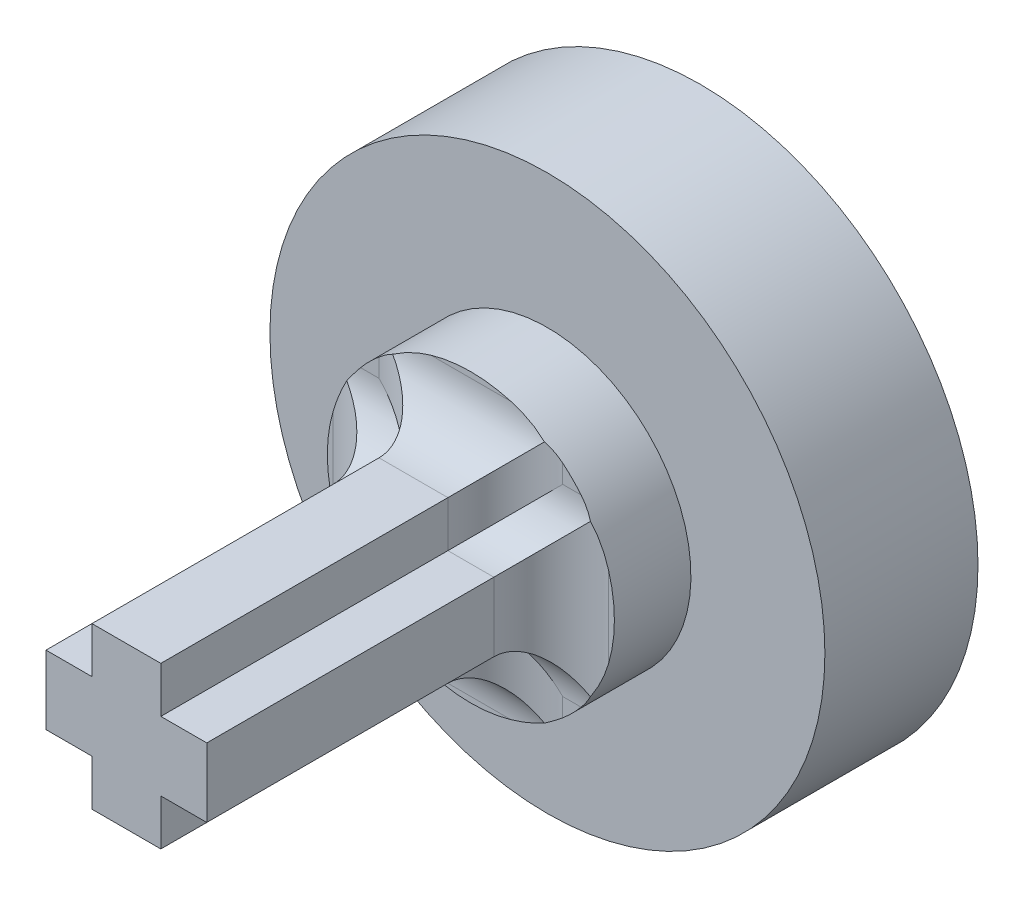
from build123d import *

# Parameters (mm, degrees)
SKETCH_1_W          = 1.8
SKETCH_1_H          = 4.2
SKETCH_1_W_2        = 4.2
SKETCH_1_H_2        = 1.8
EXTRUDE_1_DEPTH     = 9
SKETCH_3_R          = 3.75
EXTRUDE_5_DEPTH     = 2
FILLET_2_R          = 1.5
SKETCH_8_R          = 7.25
EXTRUDE_6_DEPTH     = 4
CUT_EXTRUDE_1_DEPTH = 5


with BuildPart() as part:
    # 草图1 → 凸台-拉伸1 (new body)
    with BuildSketch(Plane.XY):
        Rectangle(SKETCH_1_W, SKETCH_1_H)
        Rectangle(SKETCH_1_W_2, SKETCH_1_H_2)
    extrude(amount=EXTRUDE_1_DEPTH)

    # 草图3 → 凸台-拉伸5 (add)
    with BuildSketch(Plane(origin=(0, 0, 0), x_dir=(-1, 0, 0), z_dir=(0, 0, -1))):
        Circle(SKETCH_3_R)
    extrude(amount=EXTRUDE_5_DEPTH)

    # 圆角2
    # the kernel refuses this fillet: 1.5 mm, written as the material it adds along each edge
    with BuildSketch(Plane(origin=(-2.85, -0.9, 0), x_dir=(0, -1, 0), z_dir=(1, 0, 0))) as fillet_2_piece_1_section:
        with BuildLine():
            CenterArc((FILLET_2_R, -FILLET_2_R), FILLET_2_R, 90, 90)
            Line((0, -FILLET_2_R), (0, 0))
            Line((0, 0), (FILLET_2_R, 0))
        make_face()
    fillet_2_piece_1 = extrude(amount=4.95, mode=Mode.PRIVATE)
    fillet_2_piece_1 = split(fillet_2_piece_1, bisect_by=Plane(origin=(-2.1, -1.239592671, 0.339592671), z_dir=(1, 0, 0)), keep=Keep.TOP, mode=Mode.PRIVATE)
    add(fillet_2_piece_1)
    with BuildSketch(Plane(origin=(2.1, 0.9, 0), x_dir=(0, 1, 0), z_dir=(-1, 0, 0))) as fillet_2_piece_2_section:
        with BuildLine():
            CenterArc((FILLET_2_R, -FILLET_2_R), FILLET_2_R, 90, 90)
            Line((0, -FILLET_2_R), (0, 0))
            Line((0, 0), (FILLET_2_R, 0))
        make_face()
    fillet_2_piece_2 = extrude(amount=4.95, mode=Mode.PRIVATE)
    fillet_2_piece_2 = split(fillet_2_piece_2, bisect_by=Plane(origin=(-2.1, 1.239592671, 0.339592671), z_dir=(1, 0, 0)), keep=Keep.TOP, mode=Mode.PRIVATE)
    add(fillet_2_piece_2)
    with BuildSketch(Plane(origin=(-0.9, -2.1, 0), x_dir=(0, -1, 0), z_dir=(1, 0, 0)), Plane(origin=(0.9, 2.1, 0), x_dir=(0, 1, 0), z_dir=(-1, 0, 0)), Plane(origin=(-2.1, 0.9, 0), x_dir=(-1, 0, 0), z_dir=(0, -1, 0)), Plane(origin=(2.1, -0.9, 0), x_dir=(1, 0, 0), z_dir=(0, 1, 0))) as fillet_2_piece_3:
        with BuildLine():
            CenterArc((FILLET_2_R, -FILLET_2_R), FILLET_2_R, 90, 90)
            Line((0, -FILLET_2_R), (0, 0))
            Line((0, 0), (FILLET_2_R, 0))
        make_face()
    extrude(amount=1.8)
    with BuildSketch(Plane(origin=(0.9, -2.1, 0), x_dir=(1, 0, 0), z_dir=(0, 1, 0))) as fillet_2_piece_4_section:
        with BuildLine():
            CenterArc((FILLET_2_R, -FILLET_2_R), FILLET_2_R, 90, 90)
            Line((0, -FILLET_2_R), (0, 0))
            Line((0, 0), (FILLET_2_R, 0))
        make_face()
    fillet_2_piece_4 = extrude(amount=4.95, mode=Mode.PRIVATE)
    fillet_2_piece_4 = split(fillet_2_piece_4, bisect_by=Plane(origin=(1.239592671, 2.1, 0.339592671), z_dir=(0, -1, 0)), keep=Keep.TOP, mode=Mode.PRIVATE)
    add(fillet_2_piece_4)
    with BuildSketch(Plane(origin=(0.9, -2.85, 0), x_dir=(1, 0, 0), z_dir=(0, 1, 0))) as fillet_2_piece_5_section:
        with BuildLine():
            CenterArc((FILLET_2_R, -FILLET_2_R), FILLET_2_R, 90, 90)
            Line((0, -FILLET_2_R), (0, 0))
            Line((0, 0), (FILLET_2_R, 0))
        make_face()
    fillet_2_piece_5 = extrude(amount=4.95, mode=Mode.PRIVATE)
    fillet_2_piece_5 = split(fillet_2_piece_5, bisect_by=Plane(origin=(1.239592671, -2.1, 0.339592671), z_dir=(0, 1, 0)), keep=Keep.TOP, mode=Mode.PRIVATE)
    add(fillet_2_piece_5)
    with BuildSketch(Plane(origin=(-0.9, 2.85, 0), x_dir=(-1, 0, 0), z_dir=(0, -1, 0))) as fillet_2_piece_6_section:
        with BuildLine():
            CenterArc((FILLET_2_R, -FILLET_2_R), FILLET_2_R, 90, 90)
            Line((0, -FILLET_2_R), (0, 0))
            Line((0, 0), (FILLET_2_R, 0))
        make_face()
    fillet_2_piece_6 = extrude(amount=4.95, mode=Mode.PRIVATE)
    fillet_2_piece_6 = split(fillet_2_piece_6, bisect_by=Plane(origin=(-1.239592671, 2.1, 0.339592671), z_dir=(0, -1, 0)), keep=Keep.TOP, mode=Mode.PRIVATE)
    add(fillet_2_piece_6)
    with BuildSketch(Plane(origin=(-0.9, 2.1, 0), x_dir=(-1, 0, 0), z_dir=(0, -1, 0))) as fillet_2_piece_7_section:
        with BuildLine():
            CenterArc((FILLET_2_R, -FILLET_2_R), FILLET_2_R, 90, 90)
            Line((0, -FILLET_2_R), (0, 0))
            Line((0, 0), (FILLET_2_R, 0))
        make_face()
    fillet_2_piece_7 = extrude(amount=4.95, mode=Mode.PRIVATE)
    fillet_2_piece_7 = split(fillet_2_piece_7, bisect_by=Plane(origin=(-1.239592671, -2.1, 0.339592671), z_dir=(0, 1, 0)), keep=Keep.TOP, mode=Mode.PRIVATE)
    add(fillet_2_piece_7)
    with BuildSketch(Plane(origin=(2.85, 0.9, 0), x_dir=(0, 1, 0), z_dir=(-1, 0, 0))) as fillet_2_piece_8_section:
        with BuildLine():
            CenterArc((FILLET_2_R, -FILLET_2_R), FILLET_2_R, 90, 90)
            Line((0, -FILLET_2_R), (0, 0))
            Line((0, 0), (FILLET_2_R, 0))
        make_face()
    fillet_2_piece_8 = extrude(amount=4.95, mode=Mode.PRIVATE)
    fillet_2_piece_8 = split(fillet_2_piece_8, bisect_by=Plane(origin=(2.1, 1.239592671, 0.339592671), z_dir=(-1, 0, 0)), keep=Keep.TOP, mode=Mode.PRIVATE)
    add(fillet_2_piece_8)
    with BuildSketch(Plane(origin=(-2.1, -0.9, 0), x_dir=(0, -1, 0), z_dir=(1, 0, 0))) as fillet_2_piece_9_section:
        with BuildLine():
            CenterArc((FILLET_2_R, -FILLET_2_R), FILLET_2_R, 90, 90)
            Line((0, -FILLET_2_R), (0, 0))
            Line((0, 0), (FILLET_2_R, 0))
        make_face()
    fillet_2_piece_9 = extrude(amount=4.95, mode=Mode.PRIVATE)
    fillet_2_piece_9 = split(fillet_2_piece_9, bisect_by=Plane(origin=(2.1, -1.239592671, 0.339592671), z_dir=(-1, 0, 0)), keep=Keep.TOP, mode=Mode.PRIVATE)
    add(fillet_2_piece_9)
    with BuildSketch(Plane(origin=(2.1, -4.65, 0), x_dir=(1, 0, 0), z_dir=(0, 1, 0))) as fillet_2_piece_10a_section:
        with BuildLine():
            CenterArc((FILLET_2_R, -FILLET_2_R), FILLET_2_R, 90, 90)
            Line((0, -FILLET_2_R), (0, 0))
            Line((0, 0), (FILLET_2_R, 0))
        make_face()
    fillet_2_piece_10a = extrude(amount=5.55, mode=Mode.PRIVATE)
    fillet_2_piece_10a = fillet_2_piece_10a & Plane(origin=(0, 0, 0.370789592), x_dir=(-1, 0, 0), z_dir=(0, 0, 1)) * Cylinder(3.75, 18, mode=Mode.PRIVATE)
    fillet_2_piece_10a = split(fillet_2_piece_10a, bisect_by=Plane(origin=(2.382978133, -0.9, 0.370789592), z_dir=(0, -1, 0)), keep=Keep.TOP, mode=Mode.PRIVATE)
    with BuildSketch(Plane(origin=(0.9, -0.9, 0), x_dir=(0, -1, 0), z_dir=(1, 0, 0))) as fillet_2_piece_10b_section:
        with BuildLine():
            CenterArc((FILLET_2_R, -FILLET_2_R), FILLET_2_R, 90, 90)
            Line((0, -FILLET_2_R), (0, 0))
            Line((0, 0), (FILLET_2_R, 0))
        make_face()
    fillet_2_piece_10b = extrude(amount=4.95, mode=Mode.PRIVATE)
    fillet_2_piece_10b = fillet_2_piece_10b & Plane(origin=(0, 0, 0.356473498), x_dir=(-1, 0, 0), z_dir=(0, 0, 1)) * Cylinder(3.75, 16, mode=Mode.PRIVATE)
    fillet_2_piece_10b = split(fillet_2_piece_10b, bisect_by=Plane(origin=(2.1, -1.208975446, 0.356473498), z_dir=(1, 0, 0)), keep=Keep.TOP, mode=Mode.PRIVATE)
    fillet_2_piece_10 = fillet_2_piece_10a & fillet_2_piece_10b
    add(fillet_2_piece_10)
    with BuildSketch(Plane(origin=(5.85, 0.9, 0), x_dir=(0, 1, 0), z_dir=(-1, 0, 0))) as fillet_2_piece_11a_section:
        with BuildLine():
            CenterArc((FILLET_2_R, -FILLET_2_R), FILLET_2_R, 90, 90)
            Line((0, -FILLET_2_R), (0, 0))
            Line((0, 0), (FILLET_2_R, 0))
        make_face()
    fillet_2_piece_11a = extrude(amount=4.95, mode=Mode.PRIVATE)
    fillet_2_piece_11a = fillet_2_piece_11a & Plane(origin=(0, 0, 0.356473584), x_dir=(-1, 0, 0), z_dir=(0, 0, 1)) * Cylinder(3.75, 16, mode=Mode.PRIVATE)
    fillet_2_piece_11a = split(fillet_2_piece_11a, bisect_by=Plane(origin=(2.1, 1.208975364, 0.356473584), z_dir=(1, 0, 0)), keep=Keep.TOP, mode=Mode.PRIVATE)
    with BuildSketch(Plane(origin=(2.1, -0.9, 0), x_dir=(1, 0, 0), z_dir=(0, 1, 0))) as fillet_2_piece_11b_section:
        with BuildLine():
            CenterArc((FILLET_2_R, -FILLET_2_R), FILLET_2_R, 90, 90)
            Line((0, -FILLET_2_R), (0, 0))
            Line((0, 0), (FILLET_2_R, 0))
        make_face()
    fillet_2_piece_11b = extrude(amount=5.55, mode=Mode.PRIVATE)
    fillet_2_piece_11b = fillet_2_piece_11b & Plane(origin=(0, 0, 0.370789978), x_dir=(-1, 0, 0), z_dir=(0, 0, 1)) * Cylinder(3.75, 18, mode=Mode.PRIVATE)
    fillet_2_piece_11b = split(fillet_2_piece_11b, bisect_by=Plane(origin=(2.382978714, 0.9, 0.370789978), z_dir=(0, 1, 0)), keep=Keep.TOP, mode=Mode.PRIVATE)
    fillet_2_piece_11 = fillet_2_piece_11a & fillet_2_piece_11b
    add(fillet_2_piece_11)
    with BuildSketch(Plane(origin=(-0.9, -0.9, 0), x_dir=(-1, 0, 0), z_dir=(0, -1, 0))) as fillet_2_piece_12a_section:
        with BuildLine():
            CenterArc((FILLET_2_R, -FILLET_2_R), FILLET_2_R, 90, 90)
            Line((0, -FILLET_2_R), (0, 0))
            Line((0, 0), (FILLET_2_R, 0))
        make_face()
    fillet_2_piece_12a = extrude(amount=4.95, mode=Mode.PRIVATE)
    fillet_2_piece_12a = fillet_2_piece_12a & Plane(origin=(0, 0, 0.356473498), x_dir=(-1, 0, 0), z_dir=(0, 0, 1)) * Cylinder(3.75, 16, mode=Mode.PRIVATE)
    fillet_2_piece_12a = split(fillet_2_piece_12a, bisect_by=Plane(origin=(-1.208975446, -2.1, 0.356473498), z_dir=(0, -1, 0)), keep=Keep.TOP, mode=Mode.PRIVATE)
    with BuildSketch(Plane(origin=(-4.65, -2.1, 0), x_dir=(0, -1, 0), z_dir=(1, 0, 0))) as fillet_2_piece_12b_section:
        with BuildLine():
            CenterArc((FILLET_2_R, -FILLET_2_R), FILLET_2_R, 90, 90)
            Line((0, -FILLET_2_R), (0, 0))
            Line((0, 0), (FILLET_2_R, 0))
        make_face()
    fillet_2_piece_12b = extrude(amount=5.55, mode=Mode.PRIVATE)
    fillet_2_piece_12b = fillet_2_piece_12b & Plane(origin=(0, 0, 0.370789592), x_dir=(-1, 0, 0), z_dir=(0, 0, 1)) * Cylinder(3.75, 18, mode=Mode.PRIVATE)
    fillet_2_piece_12b = split(fillet_2_piece_12b, bisect_by=Plane(origin=(-0.9, -2.382978133, 0.370789592), z_dir=(-1, 0, 0)), keep=Keep.TOP, mode=Mode.PRIVATE)
    fillet_2_piece_12 = fillet_2_piece_12a & fillet_2_piece_12b
    add(fillet_2_piece_12)
    with BuildSketch(Plane(origin=(0.9, -5.85, 0), x_dir=(1, 0, 0), z_dir=(0, 1, 0))) as fillet_2_piece_13a_section:
        with BuildLine():
            CenterArc((FILLET_2_R, -FILLET_2_R), FILLET_2_R, 90, 90)
            Line((0, -FILLET_2_R), (0, 0))
            Line((0, 0), (FILLET_2_R, 0))
        make_face()
    fillet_2_piece_13a = extrude(amount=4.95, mode=Mode.PRIVATE)
    fillet_2_piece_13a = fillet_2_piece_13a & Plane(origin=(0, 0, 0.356473584), x_dir=(-1, 0, 0), z_dir=(0, 0, 1)) * Cylinder(3.75, 16, mode=Mode.PRIVATE)
    fillet_2_piece_13a = split(fillet_2_piece_13a, bisect_by=Plane(origin=(1.208975364, -2.1, 0.356473584), z_dir=(0, -1, 0)), keep=Keep.TOP, mode=Mode.PRIVATE)
    with BuildSketch(Plane(origin=(-0.9, -2.1, 0), x_dir=(0, -1, 0), z_dir=(1, 0, 0))) as fillet_2_piece_13b_section:
        with BuildLine():
            CenterArc((FILLET_2_R, -FILLET_2_R), FILLET_2_R, 90, 90)
            Line((0, -FILLET_2_R), (0, 0))
            Line((0, 0), (FILLET_2_R, 0))
        make_face()
    fillet_2_piece_13b = extrude(amount=5.55, mode=Mode.PRIVATE)
    fillet_2_piece_13b = fillet_2_piece_13b & Plane(origin=(0, 0, 0.370789978), x_dir=(-1, 0, 0), z_dir=(0, 0, 1)) * Cylinder(3.75, 18, mode=Mode.PRIVATE)
    fillet_2_piece_13b = split(fillet_2_piece_13b, bisect_by=Plane(origin=(0.9, -2.382978714, 0.370789978), z_dir=(1, 0, 0)), keep=Keep.TOP, mode=Mode.PRIVATE)
    fillet_2_piece_13 = fillet_2_piece_13a & fillet_2_piece_13b
    add(fillet_2_piece_13)
    with BuildSketch(Plane(origin=(4.65, 2.1, 0), x_dir=(0, 1, 0), z_dir=(-1, 0, 0))) as fillet_2_piece_14a_section:
        with BuildLine():
            CenterArc((FILLET_2_R, -FILLET_2_R), FILLET_2_R, 90, 90)
            Line((0, -FILLET_2_R), (0, 0))
            Line((0, 0), (FILLET_2_R, 0))
        make_face()
    fillet_2_piece_14a = extrude(amount=5.55, mode=Mode.PRIVATE)
    fillet_2_piece_14a = fillet_2_piece_14a & Plane(origin=(0, 0, 0.370789592), x_dir=(-1, 0, 0), z_dir=(0, 0, 1)) * Cylinder(3.75, 18, mode=Mode.PRIVATE)
    fillet_2_piece_14a = split(fillet_2_piece_14a, bisect_by=Plane(origin=(0.9, 2.382978133, 0.370789592), z_dir=(1, 0, 0)), keep=Keep.TOP, mode=Mode.PRIVATE)
    with BuildSketch(Plane(origin=(0.9, 0.9, 0), x_dir=(1, 0, 0), z_dir=(0, 1, 0))) as fillet_2_piece_14b_section:
        with BuildLine():
            CenterArc((FILLET_2_R, -FILLET_2_R), FILLET_2_R, 90, 90)
            Line((0, -FILLET_2_R), (0, 0))
            Line((0, 0), (FILLET_2_R, 0))
        make_face()
    fillet_2_piece_14b = extrude(amount=4.95, mode=Mode.PRIVATE)
    fillet_2_piece_14b = fillet_2_piece_14b & Plane(origin=(0, 0, 0.356473498), x_dir=(-1, 0, 0), z_dir=(0, 0, 1)) * Cylinder(3.75, 16, mode=Mode.PRIVATE)
    fillet_2_piece_14b = split(fillet_2_piece_14b, bisect_by=Plane(origin=(1.208975446, 2.1, 0.356473498), z_dir=(0, 1, 0)), keep=Keep.TOP, mode=Mode.PRIVATE)
    fillet_2_piece_14 = fillet_2_piece_14a & fillet_2_piece_14b
    add(fillet_2_piece_14)
    with BuildSketch(Plane(origin=(-0.9, 5.85, 0), x_dir=(-1, 0, 0), z_dir=(0, -1, 0))) as fillet_2_piece_15a_section:
        with BuildLine():
            CenterArc((FILLET_2_R, -FILLET_2_R), FILLET_2_R, 90, 90)
            Line((0, -FILLET_2_R), (0, 0))
            Line((0, 0), (FILLET_2_R, 0))
        make_face()
    fillet_2_piece_15a = extrude(amount=4.95, mode=Mode.PRIVATE)
    fillet_2_piece_15a = fillet_2_piece_15a & Plane(origin=(0, 0, 0.356473584), x_dir=(-1, 0, 0), z_dir=(0, 0, 1)) * Cylinder(3.75, 16, mode=Mode.PRIVATE)
    fillet_2_piece_15a = split(fillet_2_piece_15a, bisect_by=Plane(origin=(-1.208975364, 2.1, 0.356473584), z_dir=(0, 1, 0)), keep=Keep.TOP, mode=Mode.PRIVATE)
    with BuildSketch(Plane(origin=(0.9, 2.1, 0), x_dir=(0, 1, 0), z_dir=(-1, 0, 0))) as fillet_2_piece_15b_section:
        with BuildLine():
            CenterArc((FILLET_2_R, -FILLET_2_R), FILLET_2_R, 90, 90)
            Line((0, -FILLET_2_R), (0, 0))
            Line((0, 0), (FILLET_2_R, 0))
        make_face()
    fillet_2_piece_15b = extrude(amount=5.55, mode=Mode.PRIVATE)
    fillet_2_piece_15b = fillet_2_piece_15b & Plane(origin=(0, 0, 0.370789978), x_dir=(-1, 0, 0), z_dir=(0, 0, 1)) * Cylinder(3.75, 18, mode=Mode.PRIVATE)
    fillet_2_piece_15b = split(fillet_2_piece_15b, bisect_by=Plane(origin=(-0.9, 2.382978714, 0.370789978), z_dir=(-1, 0, 0)), keep=Keep.TOP, mode=Mode.PRIVATE)
    fillet_2_piece_15 = fillet_2_piece_15a & fillet_2_piece_15b
    add(fillet_2_piece_15)
    with BuildSketch(Plane(origin=(-2.1, 4.65, 0), x_dir=(-1, 0, 0), z_dir=(0, -1, 0))) as fillet_2_piece_16a_section:
        with BuildLine():
            CenterArc((FILLET_2_R, -FILLET_2_R), FILLET_2_R, 90, 90)
            Line((0, -FILLET_2_R), (0, 0))
            Line((0, 0), (FILLET_2_R, 0))
        make_face()
    fillet_2_piece_16a = extrude(amount=5.55, mode=Mode.PRIVATE)
    fillet_2_piece_16a = fillet_2_piece_16a & Plane(origin=(0, 0, 0.370789592), x_dir=(-1, 0, 0), z_dir=(0, 0, 1)) * Cylinder(3.75, 18, mode=Mode.PRIVATE)
    fillet_2_piece_16a = split(fillet_2_piece_16a, bisect_by=Plane(origin=(-2.382978133, 0.9, 0.370789592), z_dir=(0, 1, 0)), keep=Keep.TOP, mode=Mode.PRIVATE)
    with BuildSketch(Plane(origin=(-0.9, 0.9, 0), x_dir=(0, 1, 0), z_dir=(-1, 0, 0))) as fillet_2_piece_16b_section:
        with BuildLine():
            CenterArc((FILLET_2_R, -FILLET_2_R), FILLET_2_R, 90, 90)
            Line((0, -FILLET_2_R), (0, 0))
            Line((0, 0), (FILLET_2_R, 0))
        make_face()
    fillet_2_piece_16b = extrude(amount=4.95, mode=Mode.PRIVATE)
    fillet_2_piece_16b = fillet_2_piece_16b & Plane(origin=(0, 0, 0.356473498), x_dir=(-1, 0, 0), z_dir=(0, 0, 1)) * Cylinder(3.75, 16, mode=Mode.PRIVATE)
    fillet_2_piece_16b = split(fillet_2_piece_16b, bisect_by=Plane(origin=(-2.1, 1.208975446, 0.356473498), z_dir=(-1, 0, 0)), keep=Keep.TOP, mode=Mode.PRIVATE)
    fillet_2_piece_16 = fillet_2_piece_16a & fillet_2_piece_16b
    add(fillet_2_piece_16)
    with BuildSketch(Plane(origin=(-5.85, -0.9, 0), x_dir=(0, -1, 0), z_dir=(1, 0, 0))) as fillet_2_piece_17a_section:
        with BuildLine():
            CenterArc((FILLET_2_R, -FILLET_2_R), FILLET_2_R, 90, 90)
            Line((0, -FILLET_2_R), (0, 0))
            Line((0, 0), (FILLET_2_R, 0))
        make_face()
    fillet_2_piece_17a = extrude(amount=4.95, mode=Mode.PRIVATE)
    fillet_2_piece_17a = fillet_2_piece_17a & Plane(origin=(0, 0, 0.356473584), x_dir=(-1, 0, 0), z_dir=(0, 0, 1)) * Cylinder(3.75, 16, mode=Mode.PRIVATE)
    fillet_2_piece_17a = split(fillet_2_piece_17a, bisect_by=Plane(origin=(-2.1, -1.208975364, 0.356473584), z_dir=(-1, 0, 0)), keep=Keep.TOP, mode=Mode.PRIVATE)
    with BuildSketch(Plane(origin=(-2.1, 0.9, 0), x_dir=(-1, 0, 0), z_dir=(0, -1, 0))) as fillet_2_piece_17b_section:
        with BuildLine():
            CenterArc((FILLET_2_R, -FILLET_2_R), FILLET_2_R, 90, 90)
            Line((0, -FILLET_2_R), (0, 0))
            Line((0, 0), (FILLET_2_R, 0))
        make_face()
    fillet_2_piece_17b = extrude(amount=5.55, mode=Mode.PRIVATE)
    fillet_2_piece_17b = fillet_2_piece_17b & Plane(origin=(0, 0, 0.370789978), x_dir=(-1, 0, 0), z_dir=(0, 0, 1)) * Cylinder(3.75, 18, mode=Mode.PRIVATE)
    fillet_2_piece_17b = split(fillet_2_piece_17b, bisect_by=Plane(origin=(-2.382978714, -0.9, 0.370789978), z_dir=(0, -1, 0)), keep=Keep.TOP, mode=Mode.PRIVATE)
    fillet_2_piece_17 = fillet_2_piece_17a & fillet_2_piece_17b
    add(fillet_2_piece_17)

    # 草图8 → 凸台-拉伸6 (add)
    with BuildSketch(Plane(origin=(0, 0, -2), x_dir=(-1, 0, 0), z_dir=(0, 0, -1))):
        Circle(SKETCH_8_R)
    extrude(amount=EXTRUDE_6_DEPTH)

    # 草图7 → 切除-拉伸1 (cut)
    with BuildSketch(Plane(origin=(0, 0, -6), x_dir=(-1, 0, 0), z_dir=(0, 0, -1))):
        with BuildLine():
            Line((1.3, -1.095445115), (1.3, 1.095445115))
            ThreePointArc((1.3, 1.095445115), (-1.7, 0), (1.3, -1.095445115))
        make_face()
    extrude(amount=-CUT_EXTRUDE_1_DEPTH, mode=Mode.SUBTRACT)


solid = part.part
